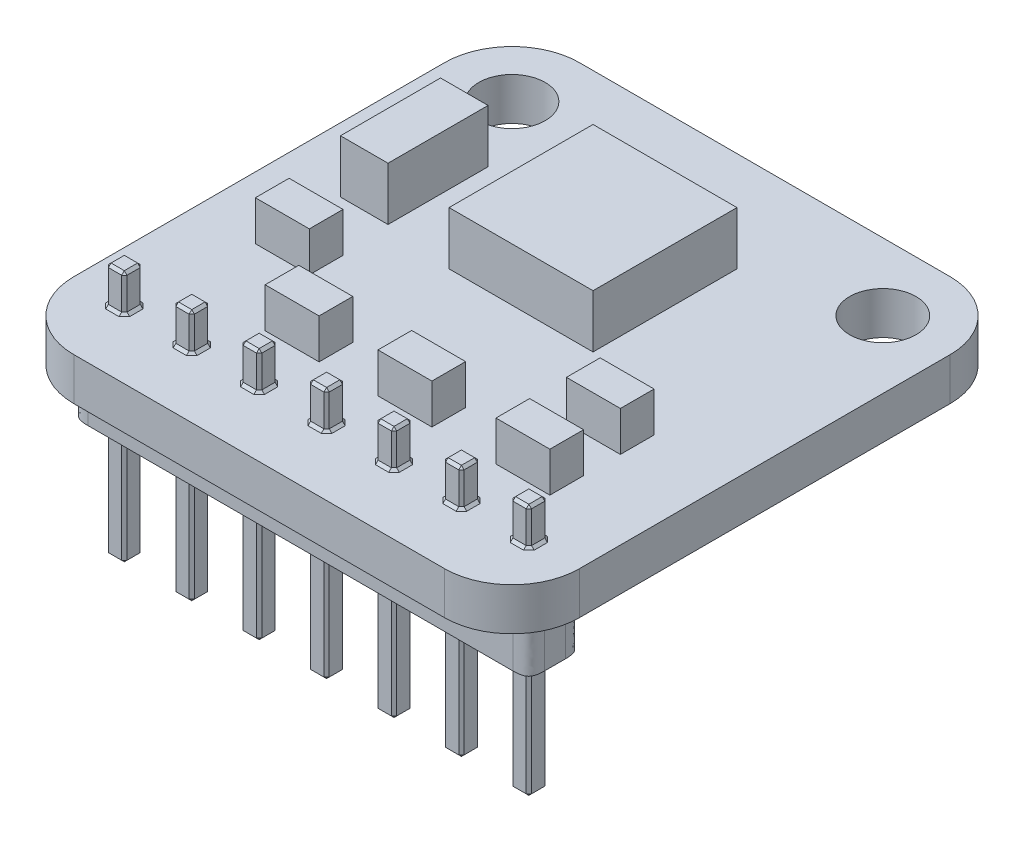
from build123d import *

# Parameters (mm, degrees)
SKETCH1_R                = 1.25
BOSS_EXTRUDE1_DEPTH      = 1.6
BOSS_EXTRUDE2_DEPTH      = 6.5
BOSS_EXTRUDE2_DEPTH_BACK = 3
SKETCH3_W                = 0.7
SKETCH3_H                = 0.7
SKETCH4_W                = 17.21
SKETCH4_H                = 1.98
BOSS_EXTRUDE3_DEPTH      = 2
SKETCH5_W                = 5.423330206
SKETCH5_H                = 5.423330206
BOSS_EXTRUDE4_DEPTH      = 2
SKETCH6_W                = 2.032
SKETCH6_H                = 1.27
BOSS_EXTRUDE5_DEPTH      = 1.5
SKETCH7_W                = 1.791519366
SKETCH7_H                = 3.76966122
BOSS_EXTRUDE6_DEPTH      = 2
FILLET1_SIZE             = 0.6
CHAMFER2_SIZE            = 0.1


with BuildPart() as part:
    # Sketch1 → Boss-Extrude1 (new body)
    with BuildSketch(Plane(origin=(0, 0, 0), x_dir=(1, 0, 0), z_dir=(0, 1, 0))):
        with BuildLine():
            Line((-9.525, 2.54), (-9.525, 16.51))
            ThreePointArc((-9.525, 16.51), (-8.781051224, 18.306051224), (-6.985, 19.05))
            Line((-6.985, 19.05), (6.985, 19.05))
            ThreePointArc((6.985, 19.05), (8.781051224, 18.306051224), (9.525, 16.51))
            Line((9.525, 16.51), (9.525, 2.54))
            ThreePointArc((9.525, 2.54), (8.781051224, 0.743948776), (6.985, 0))
            Line((6.985, 0), (-6.985, 0))
            ThreePointArc((-6.985, 0), (-8.781051224, 0.743948776), (-9.525, 2.54))
        make_face()
        with Locations(Location((-6.985, 16.51, 0), (0, 0, 270))):
            Circle(SKETCH1_R, mode=Mode.SUBTRACT)
        with Locations(Location((6.985, 16.51, 0), (0, 0, 270))):
            Circle(SKETCH1_R, mode=Mode.SUBTRACT)
    extrude(amount=BOSS_EXTRUDE1_DEPTH)

    # Sketch3 → Boss-Extrude2 (add, two sides: drawn at the far end of the back side and taken through both)
    with BuildSketch(Plane.XZ.offset(-BOSS_EXTRUDE2_DEPTH_BACK)):
        with Locations((5.08, -2.54)):
            Rectangle(SKETCH3_W, SKETCH3_H)
        with Locations((7.62, -2.54)):
            Rectangle(SKETCH3_W, SKETCH3_H)
        with Locations((2.54, -2.54)):
            Rectangle(SKETCH3_W, SKETCH3_H)
        with Locations((0, -2.54)):
            Rectangle(SKETCH3_W, SKETCH3_H)
        with Locations((-2.54, -2.54)):
            Rectangle(SKETCH3_W, SKETCH3_H)
        with Locations((-5.08, -2.54)):
            Rectangle(SKETCH3_W, SKETCH3_H)
        with Locations((-7.62, -2.54)):
            Rectangle(SKETCH3_W, SKETCH3_H)
    extrude(amount=BOSS_EXTRUDE2_DEPTH + BOSS_EXTRUDE2_DEPTH_BACK)

    # Sketch4 → Boss-Extrude3 (add)
    with BuildSketch(Plane.XZ):
        with Locations((0, -2.54)):
            Rectangle(SKETCH4_W, SKETCH4_H)
    extrude(amount=BOSS_EXTRUDE3_DEPTH)

    # Sketch5 → Boss-Extrude4 (add)
    with BuildSketch(Plane(origin=(0, 1.6, 0), x_dir=(1, 0, 0), z_dir=(0, 1, 0))):
        with Locations((0, 12.57726072)):
            Rectangle(SKETCH5_W, SKETCH5_H)
    extrude(amount=BOSS_EXTRUDE4_DEPTH)

    # Sketch6 → Boss-Extrude5 (add)
    with BuildSketch(Plane(origin=(0, 1.6, 0), x_dir=(1, 0, 0), z_dir=(0, 1, 0))):
        with Locations((-6.164776914, 7.673147474)):
            Rectangle(SKETCH6_W, SKETCH6_H)
        with Locations((-3.141750318, 5.017322921)):
            Rectangle(SKETCH6_W, SKETCH6_H)
        with Locations((1.108996537, 5.017322921)):
            Rectangle(SKETCH6_W, SKETCH6_H)
        with Locations((5.553313169, 5.017322921)):
            Rectangle(SKETCH6_W, SKETCH6_H)
        with Locations((5.553313169, 7.673147474)):
            Rectangle(SKETCH6_W, SKETCH6_H)
    extrude(amount=BOSS_EXTRUDE5_DEPTH)

    # Sketch7 → Boss-Extrude6 (add)
    with BuildSketch(Plane(origin=(0, 1.6, 0), x_dir=(1, 0, 0), z_dir=(0, 1, 0))):
        with Locations((-6.204383117, 12.047782402)):
            Rectangle(SKETCH7_W, SKETCH7_H)
    extrude(amount=BOSS_EXTRUDE6_DEPTH)

    # Fillet1
    # a fillet whose section is not a circle: 0.6 mm, written as the material it takes off along each edge
    with BuildSketch(Plane(origin=(8.605, 0, -3.53), x_dir=(-1, 0, 0), z_dir=(0, -1, 0)), Plane(origin=(8.605, 0, -1.55), x_dir=(0, 0, -1), z_dir=(0, -1, 0)), Plane(origin=(-8.605, 0, -1.55), x_dir=(1, 0, 0), z_dir=(0, -1, 0))) as fillet1_piece_1:
        with BuildLine():
            Bezier((FILLET1_SIZE, 0), (0, 0), (0, -FILLET1_SIZE), weights=[1, 1.414213562, 1])
            Line((0, -FILLET1_SIZE), (0, 0))
            Line((0, 0), (FILLET1_SIZE, 0))
        make_face()
    extrude(amount=3.5, mode=Mode.SUBTRACT)
    with BuildSketch(Plane(origin=(-8.605, 0, -3.53), x_dir=(1, 0, 0), z_dir=(0, -1, 0))) as fillet1_piece_2:
        with BuildLine():
            Bezier((FILLET1_SIZE, 0), (0, 0), (0, FILLET1_SIZE), weights=[1, 1.414213562, 1])
            Line((0, FILLET1_SIZE), (0, 0))
            Line((0, 0), (FILLET1_SIZE, 0))
        make_face()
    extrude(amount=3.5, mode=Mode.SUBTRACT)

    # Chamfer2
    chamfer2_edges = [part.edges().sort_by_distance(p)[0] for p in [
        (-0.35, -6.5, -2.54),
        (-2.54, 1.6, -2.89),
        (-2.89, -4.25, -2.89),
        (-2.19, 1.6, -2.54),
        (-2.19, -4.25, -2.89),
        (-2.54, 1.6, -2.19),
        (-2.19, -4.25, -2.19),
        (-2.89, 1.6, -2.54),
        (-2.89, -4.25, -2.19),
        (-2.89, 2.3, -2.89),
        (-2.54, 3, -2.89),
        (-2.19, 2.3, -2.89),
        (-2.19, 3, -2.54),
        (-2.19, 2.3, -2.19),
        (-2.54, 3, -2.19),
        (-2.89, 2.3, -2.19),
        (-2.89, 3, -2.54),
        (-2.54, -6.5, -2.89),
        (-2.19, -6.5, -2.54),
        (-2.54, -6.5, -2.19),
        (-2.89, -6.5, -2.54),
        (-5.08, 1.6, -2.89),
        (-5.43, -4.25, -2.89),
        (-4.73, 1.6, -2.54),
        (-4.73, -4.25, -2.89),
        (-5.08, 1.6, -2.19),
        (-4.73, -4.25, -2.19),
        (-5.43, 1.6, -2.54),
        (-5.43, -4.25, -2.19),
        (-5.43, 2.3, -2.89),
        (-5.08, 3, -2.89),
        (-4.73, 2.3, -2.89),
        (-4.73, 3, -2.54),
        (-4.73, 2.3, -2.19),
        (-5.08, 3, -2.19),
        (-5.43, 2.3, -2.19),
        (-5.43, 3, -2.54),
        (-5.08, -6.5, -2.89),
        (-4.73, -6.5, -2.54),
        (-5.08, -6.5, -2.19),
        (-5.43, -6.5, -2.54),
        (-7.62, 1.6, -2.89),
        (-7.97, -4.25, -2.89),
        (-7.27, 1.6, -2.54),
        (-7.27, -4.25, -2.89),
        (-7.62, 1.6, -2.19),
        (-7.27, -4.25, -2.19),
        (-7.97, 1.6, -2.54),
        (-7.97, -4.25, -2.19),
        (-7.97, 2.3, -2.89),
        (-7.62, 3, -2.89),
        (-7.27, 2.3, -2.89),
        (-7.27, 3, -2.54),
        (-7.27, 2.3, -2.19),
        (-7.62, 3, -2.19),
        (-7.97, 2.3, -2.19),
        (-7.97, 3, -2.54),
        (-7.62, -6.5, -2.89),
        (-7.27, -6.5, -2.54),
        (-7.62, -6.5, -2.19),
        (-7.97, -6.5, -2.54),
        (-7.62, -2, -2.89),
        (-7.97, -2, -2.54),
        (-7.62, -2, -2.19),
        (-7.27, -2, -2.54),
        (-5.08, -2, -2.89),
        (-5.43, -2, -2.54),
        (-5.08, -2, -2.19),
        (-4.73, -2, -2.54),
        (-2.54, -2, -2.89),
        (-2.89, -2, -2.54),
        (-2.54, -2, -2.19),
        (-2.19, -2, -2.54),
        (0, -2, -2.89),
        (-0.35, -2, -2.54),
        (0, -2, -2.19),
        (0.35, -2, -2.54),
        (2.54, -2, -2.89),
        (2.19, -2, -2.54),
        (2.54, -2, -2.19),
        (2.89, -2, -2.54),
        (5.08, -2, -2.89),
        (4.73, -2, -2.54),
        (5.08, -2, -2.19),
        (5.43, -2, -2.54),
        (7.27, -2, -2.54),
        (7.62, -2, -2.19),
        (7.97, -2, -2.54),
        (7.62, -2, -2.89),
        (7.27, 1.6, -2.54),
        (7.27, -4.25, -2.19),
        (7.62, 1.6, -2.89),
        (7.27, -4.25, -2.89),
        (7.97, 1.6, -2.54),
        (7.97, -4.25, -2.89),
        (7.62, 1.6, -2.19),
        (7.97, -4.25, -2.19),
        (7.27, 2.3, -2.19),
        (7.27, 3, -2.54),
        (7.27, 2.3, -2.89),
        (7.62, 3, -2.89),
        (7.97, 2.3, -2.89),
        (7.97, 3, -2.54),
        (7.97, 2.3, -2.19),
        (7.62, 3, -2.19),
        (7.27, -6.5, -2.54),
        (7.62, -6.5, -2.89),
        (7.97, -6.5, -2.54),
        (7.62, -6.5, -2.19),
        (5.08, 1.6, -2.89),
        (4.73, -4.25, -2.89),
        (5.43, 1.6, -2.54),
        (5.43, -4.25, -2.89),
        (5.08, 1.6, -2.19),
        (5.43, -4.25, -2.19),
        (4.73, 1.6, -2.54),
        (4.73, -4.25, -2.19),
        (4.73, 2.3, -2.89),
        (5.08, 3, -2.89),
        (5.43, 2.3, -2.89),
        (5.43, 3, -2.54),
        (5.43, 2.3, -2.19),
        (5.08, 3, -2.19),
        (4.73, 2.3, -2.19),
        (4.73, 3, -2.54),
        (5.08, -6.5, -2.89),
        (5.43, -6.5, -2.54),
        (5.08, -6.5, -2.19),
        (4.73, -6.5, -2.54),
        (2.54, 1.6, -2.89),
        (2.19, -4.25, -2.89),
        (2.89, 1.6, -2.54),
        (2.89, -4.25, -2.89),
        (2.54, 1.6, -2.19),
        (2.89, -4.25, -2.19),
        (2.19, 1.6, -2.54),
        (2.19, -4.25, -2.19),
        (2.19, 2.3, -2.89),
        (2.54, 3, -2.89),
        (2.89, 2.3, -2.89),
        (2.89, 3, -2.54),
        (2.89, 2.3, -2.19),
        (2.54, 3, -2.19),
        (2.19, 2.3, -2.19),
        (2.19, 3, -2.54),
        (2.54, -6.5, -2.89),
        (2.89, -6.5, -2.54),
        (2.54, -6.5, -2.19),
        (2.19, -6.5, -2.54),
        (0, 1.6, -2.89),
        (-0.35, -4.25, -2.89),
        (0.35, 1.6, -2.54),
        (0.35, -4.25, -2.89),
        (0, 1.6, -2.19),
        (0.35, -4.25, -2.19),
        (-0.35, 1.6, -2.54),
        (-0.35, -4.25, -2.19),
        (-0.35, 2.3, -2.89),
        (0, 3, -2.89),
        (0.35, 2.3, -2.89),
        (0.35, 3, -2.54),
        (0.35, 2.3, -2.19),
        (0, 3, -2.19),
        (-0.35, 2.3, -2.19),
        (-0.35, 3, -2.54),
        (0, -6.5, -2.89),
        (0.35, -6.5, -2.54),
        (0, -6.5, -2.19),
    ]]
    chamfer(chamfer2_edges, length=CHAMFER2_SIZE)


solid = part.part
